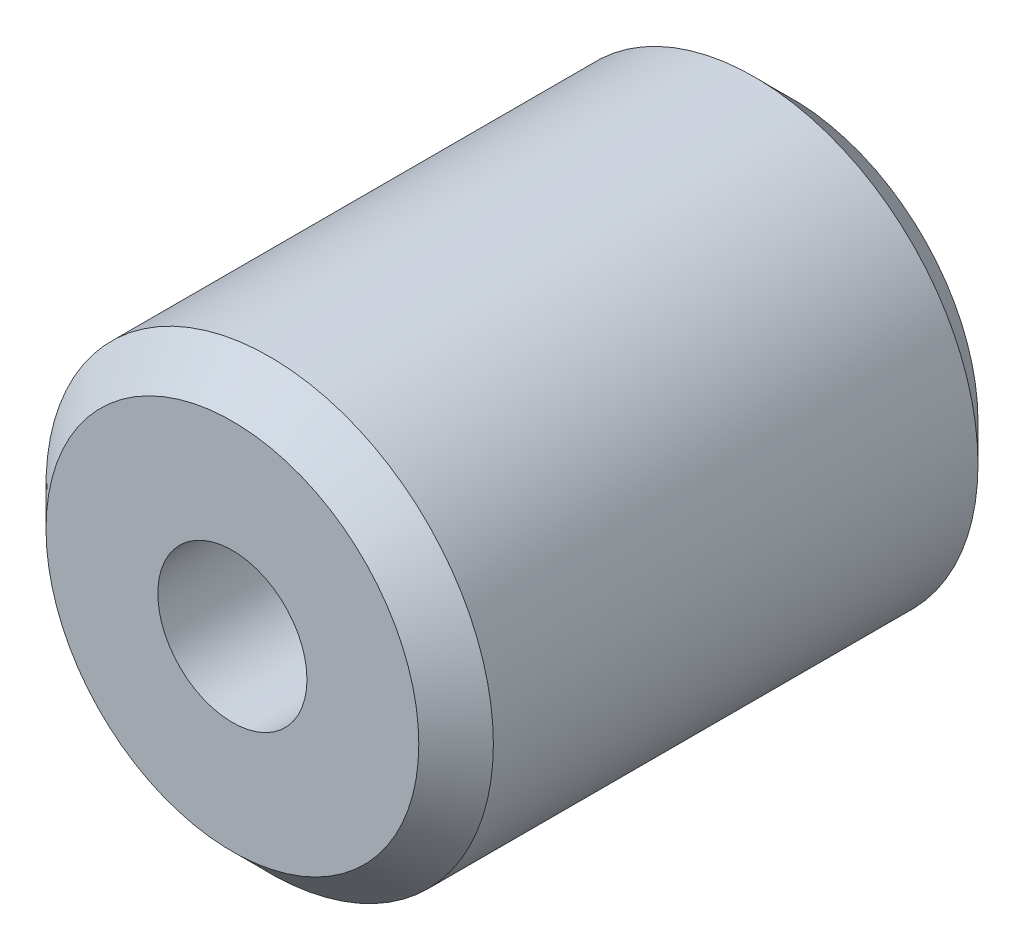
from build123d import *

# Parameters (mm, degrees)
SKETCH1_R           = 6
BOSS_EXTRUDE1_DEPTH = 15
SKETCH2_R           = 2
CUT_EXTRUDE1_DEPTH  = 18.23368794
CHAMFER1_SIZE       = 1


with BuildPart() as part:
    # Sketch1 → Boss-Extrude1 (new body)
    with BuildSketch(Plane.XY):
        Circle(SKETCH1_R)
    extrude(amount=BOSS_EXTRUDE1_DEPTH)

    # Sketch2 → Cut-Extrude1 (cut, through all)
    with BuildSketch(Plane.XY):
        Circle(SKETCH2_R)
    extrude(amount=CUT_EXTRUDE1_DEPTH, mode=Mode.SUBTRACT)

    # Chamfer1
    chamfer1_edges = [part.edges().sort_by_distance(p)[0] for p in [
        (-6, 0, 0),
        (-6, 0, 15),
    ]]
    chamfer(chamfer1_edges, length=CHAMFER1_SIZE)


solid = part.part
